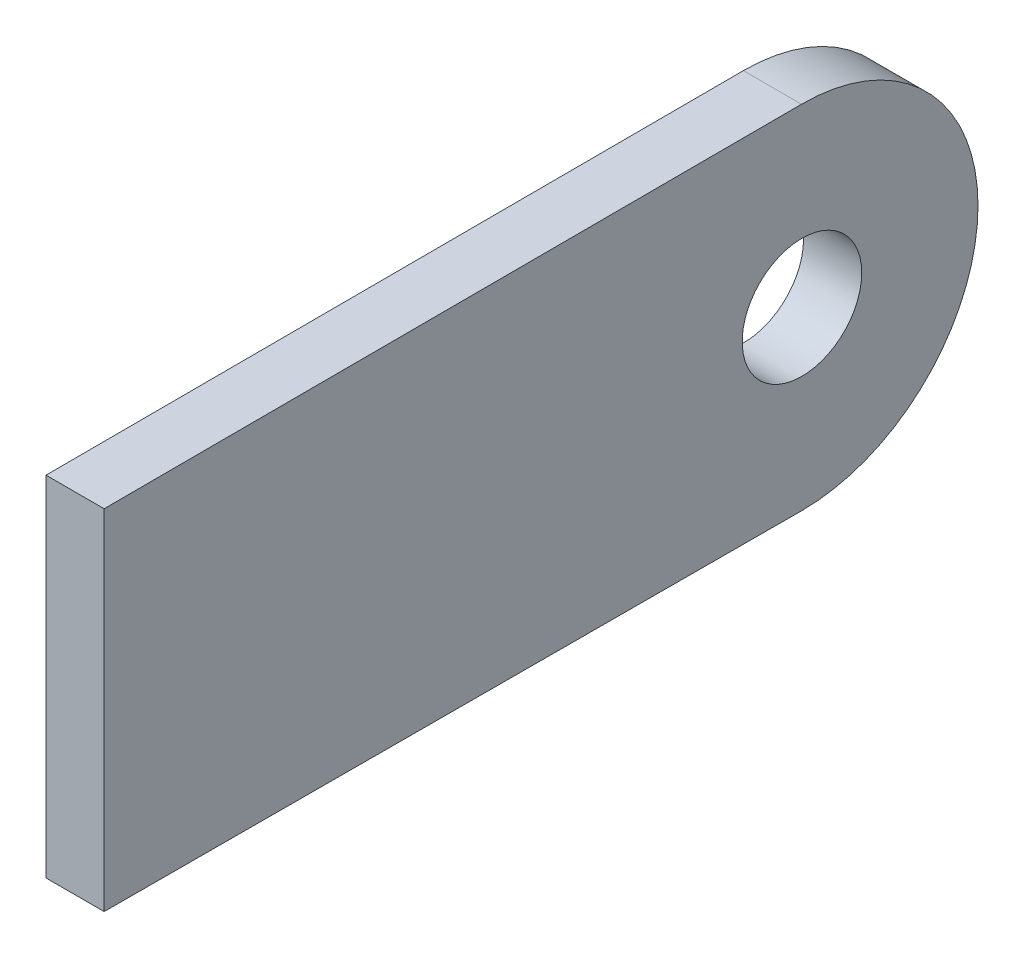
from build123d import *

# Parameters (mm, degrees)
SKETCH1_R           = 3.2639
BOSS_EXTRUDE1_DEPTH = 1.5875


with BuildPart() as part:
    # Sketch1 → Boss-Extrude1 (new, symmetric)
    with BuildSketch(Plane(origin=(0, 0, 0), x_dir=(0, 0, -1), z_dir=(1, 0, 0))):
        with BuildLine():
            Line((-38.1, 9.525), (-38.1, -9.525))
            Line((-38.1, -9.525), (-0.02243898, -9.613873814))
            ThreePointArc((-0.02243898, -9.613873814), (9.6139, 0), (-0.02243898, 9.613873814))
            Line((-0.02243898, 9.613873814), (-38.1, 9.525))
        make_face()
        Circle(SKETCH1_R, mode=Mode.SUBTRACT)
    extrude(amount=BOSS_EXTRUDE1_DEPTH, both=True)


solid = part.part
